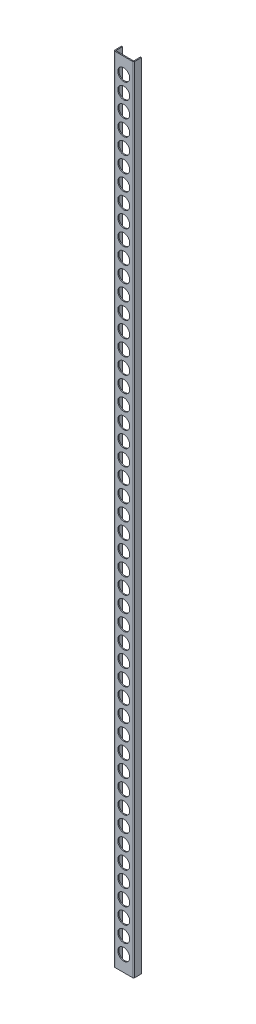
from build123d import *

# Parameters (mm, degrees)
BASE_FLANGE1_DEPTH = 2540
SKETCH6_R          = 19.05
CUT_EXTRUDE1_DEPTH = 3.175


# Read off the part's stored shape, not the designer's step: Base-Flange1
with BuildPart() as part:
    # Base-Flange1 outline → Base-Flange1 (new body)
    with BuildSketch(Plane(origin=(0, 0, 0), x_dir=(1, 0, 0), z_dir=(0, 1, 0))):
        with BuildLine():
            Line((-28.575, 3.175), (-28.575, 25.4))
            Line((-28.575, 25.4), (-31.75, 25.4))
            Line((-31.75, 25.4), (-31.75, 3.175))
            ThreePointArc((-31.75, 3.175), (-30.82006403, 0.92993597), (-28.575, 0))
            Line((-28.575, 0), (28.575, 0))
            ThreePointArc((28.575, 0), (30.82006403, 0.92993597), (31.75, 3.175))
            Line((31.75, 3.175), (31.75, 25.4))
            Line((31.75, 25.4), (28.575, 25.4))
            Line((28.575, 25.4), (28.575, 3.175))
            Line((28.575, 3.175), (-28.575, 3.175))
        make_face()
    extrude(amount=BASE_FLANGE1_DEPTH)

    # Sketch6 → Cut-Extrude1 (cut)
    with BuildSketch(Plane.XY):
        with Locations((0, 50.8)):
            Circle(SKETCH6_R)
        with Locations((0, 101.6)):
            Circle(SKETCH6_R)
        with Locations((0, 152.4)):
            Circle(SKETCH6_R)
        with Locations((0, 203.2)):
            Circle(SKETCH6_R)
        with Locations((0, 254)):
            Circle(SKETCH6_R)
        with Locations((0, 304.8)):
            Circle(SKETCH6_R)
        with Locations((0, 355.6)):
            Circle(SKETCH6_R)
        with Locations((0, 406.4)):
            Circle(SKETCH6_R)
        with Locations((0, 457.2)):
            Circle(SKETCH6_R)
        with Locations((0, 508)):
            Circle(SKETCH6_R)
        with Locations((0, 558.8)):
            Circle(SKETCH6_R)
        with Locations((0, 609.6)):
            Circle(SKETCH6_R)
        with Locations((0, 660.4)):
            Circle(SKETCH6_R)
        with Locations((0, 711.2)):
            Circle(SKETCH6_R)
        with Locations((0, 762)):
            Circle(SKETCH6_R)
        with Locations((0, 812.8)):
            Circle(SKETCH6_R)
        with Locations((0, 863.6)):
            Circle(SKETCH6_R)
        with Locations((0, 914.4)):
            Circle(SKETCH6_R)
        with Locations((0, 965.2)):
            Circle(SKETCH6_R)
        with Locations((0, 1016)):
            Circle(SKETCH6_R)
        with Locations((0, 1066.8)):
            Circle(SKETCH6_R)
        with Locations((0, 1117.6)):
            Circle(SKETCH6_R)
        with Locations((0, 1168.4)):
            Circle(SKETCH6_R)
        with Locations((0, 1219.2)):
            Circle(SKETCH6_R)
        with Locations((0, 1270)):
            Circle(SKETCH6_R)
        with Locations((0, 1320.8)):
            Circle(SKETCH6_R)
        with Locations((0, 1371.6)):
            Circle(SKETCH6_R)
        with Locations((0, 1422.4)):
            Circle(SKETCH6_R)
        with Locations((0, 1473.2)):
            Circle(SKETCH6_R)
        with Locations((0, 1524)):
            Circle(SKETCH6_R)
        with Locations((0, 1574.8)):
            Circle(SKETCH6_R)
        with Locations((0, 1625.6)):
            Circle(SKETCH6_R)
        with Locations((0, 1676.4)):
            Circle(SKETCH6_R)
        with Locations((0, 1727.2)):
            Circle(SKETCH6_R)
        with Locations((0, 1778)):
            Circle(SKETCH6_R)
        with Locations((0, 1828.8)):
            Circle(SKETCH6_R)
        with Locations((0, 1879.6)):
            Circle(SKETCH6_R)
        with Locations((0, 1930.4)):
            Circle(SKETCH6_R)
        with Locations((0, 1981.2)):
            Circle(SKETCH6_R)
        with Locations((0, 2032)):
            Circle(SKETCH6_R)
        with Locations((0, 2082.8)):
            Circle(SKETCH6_R)
        with Locations((0, 2133.6)):
            Circle(SKETCH6_R)
        with Locations((0, 2184.4)):
            Circle(SKETCH6_R)
        with Locations((0, 2235.2)):
            Circle(SKETCH6_R)
        with Locations((0, 2286)):
            Circle(SKETCH6_R)
        with Locations((0, 2336.8)):
            Circle(SKETCH6_R)
        with Locations((0, 2387.6)):
            Circle(SKETCH6_R)
        with Locations((0, 2438.4)):
            Circle(SKETCH6_R)
        with Locations((0, 2489.2)):
            Circle(SKETCH6_R)
    extrude(amount=-CUT_EXTRUDE1_DEPTH, mode=Mode.SUBTRACT)


solid = part.part
